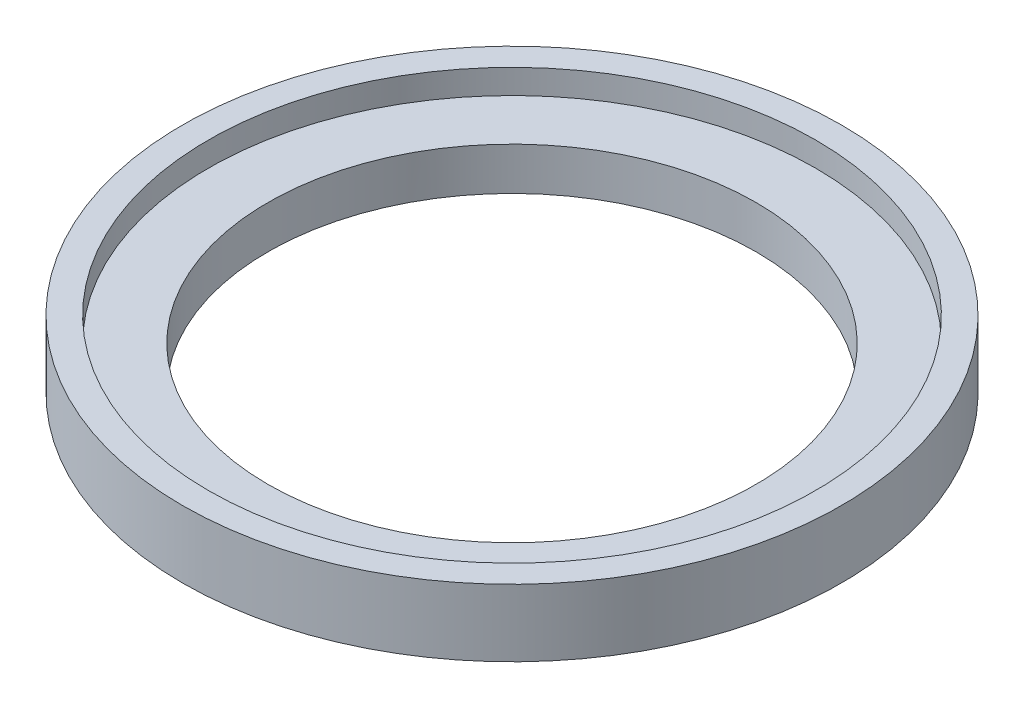
from build123d import *

# Parameters (mm, degrees)
SKETCH1_R           = 54
SKETCH1_R_2         = 40
BOSS_EXTRUDE1_DEPTH = 2.5
SKETCH2_R           = 54
SKETCH2_R_2         = 49.75
BOSS_EXTRUDE2_DEPTH = 4
BOSS_EXTRUDE3_START = 4.5
SKETCH3_R           = 54
SKETCH3_R_2         = 49.5
SKETCH3_R_3         = 44.5
SKETCH3_R_4         = 40
BOSS_EXTRUDE3_DEPTH = 4.5


with BuildPart() as part:
    # Sketch1 → Boss-Extrude1 (new body)
    with BuildSketch(Plane(origin=(0, 0, 0), x_dir=(1, 0, 0), z_dir=(0, 1, 0))):
        Circle(SKETCH1_R)
        Circle(SKETCH1_R_2, mode=Mode.SUBTRACT)
    extrude(amount=BOSS_EXTRUDE1_DEPTH)

    # Sketch2 → Boss-Extrude2 (add)
    with BuildSketch(Plane(origin=(0, 2.5, 0), x_dir=(1, 0, 0), z_dir=(0, 1, 0))):
        Circle(SKETCH2_R)
        Circle(SKETCH2_R_2, mode=Mode.SUBTRACT)
    extrude(amount=BOSS_EXTRUDE2_DEPTH)

    # Sketch3 → Boss-Extrude3 (add)
    # profile 1 of 2: a face of its own
    with BuildSketch(Plane.XZ.offset(BOSS_EXTRUDE3_START)):
        Circle(SKETCH3_R)
        Circle(SKETCH3_R_2, mode=Mode.SUBTRACT)
    # profile 2 of 2: a face of its own
    with BuildSketch(Plane.XZ.offset(BOSS_EXTRUDE3_START)):
        Circle(SKETCH3_R_3)
        Circle(SKETCH3_R_4, mode=Mode.SUBTRACT)
    extrude(amount=-BOSS_EXTRUDE3_DEPTH)


solid = part.part
